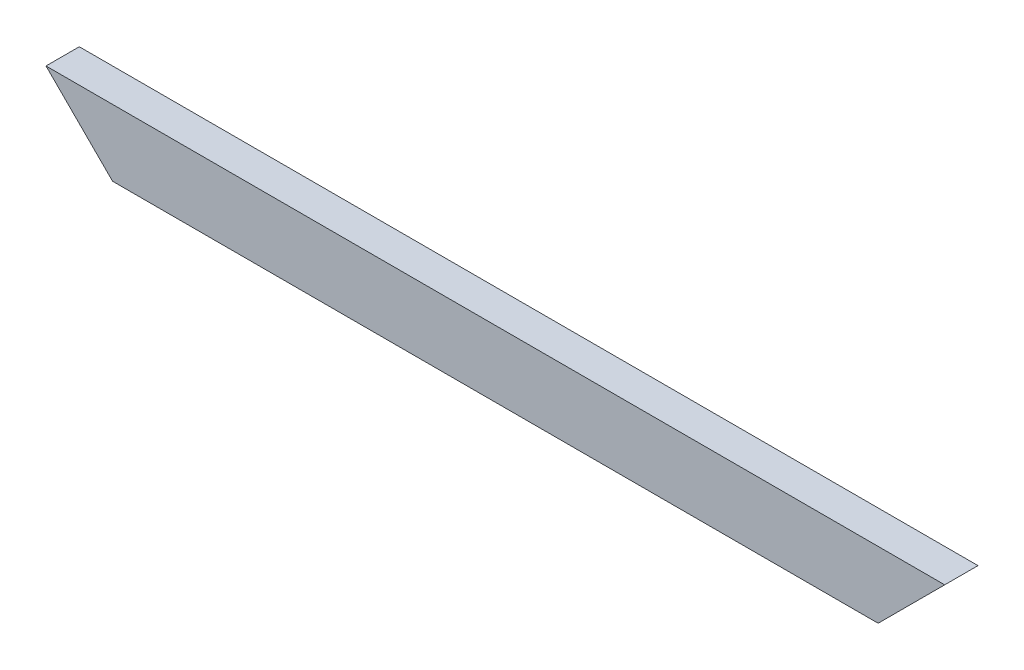
from build123d import *

# Parameters (mm, degrees)
SKETCH1_W               = 25.4
SKETCH1_H               = 50.8
SKETCH1_W_2             = 19.05
SKETCH1_H_2             = 44.45
BOSS_EXTRUDE1_DEPTH     = 342.9
CUT_EXTRUDE1_DEPTH      = 345.776347797
CUT_EXTRUDE1_DEPTH_BACK = 345.776347797


with BuildPart() as part:
    # Sketch1 → Boss-Extrude1 (new, symmetric)
    with BuildSketch(Plane(origin=(0, 0, 0), x_dir=(0, 0, -1), z_dir=(1, 0, 0))):
        Rectangle(SKETCH1_W, SKETCH1_H)
        Rectangle(SKETCH1_W_2, SKETCH1_H_2, mode=Mode.SUBTRACT)
    extrude(amount=BOSS_EXTRUDE1_DEPTH, both=True)

    # Sketch2 → Cut-Extrude1 (cut, two sides: drawn at the far end of the back side and taken through both)
    with BuildSketch(Plane(origin=(0, 0, -12.7), x_dir=(-1, 0, 0), z_dir=(0, 0, -1)).offset(-CUT_EXTRUDE1_DEPTH_BACK)):
        Polygon((342.9, -25.4), (342.9, 25.4), (292.1, -25.4), align=None)
        Polygon((-342.9, -25.4), (-292.1, -25.4), (-342.9, 25.4), align=None)
    extrude(amount=CUT_EXTRUDE1_DEPTH + CUT_EXTRUDE1_DEPTH_BACK, mode=Mode.SUBTRACT)


solid = part.part
